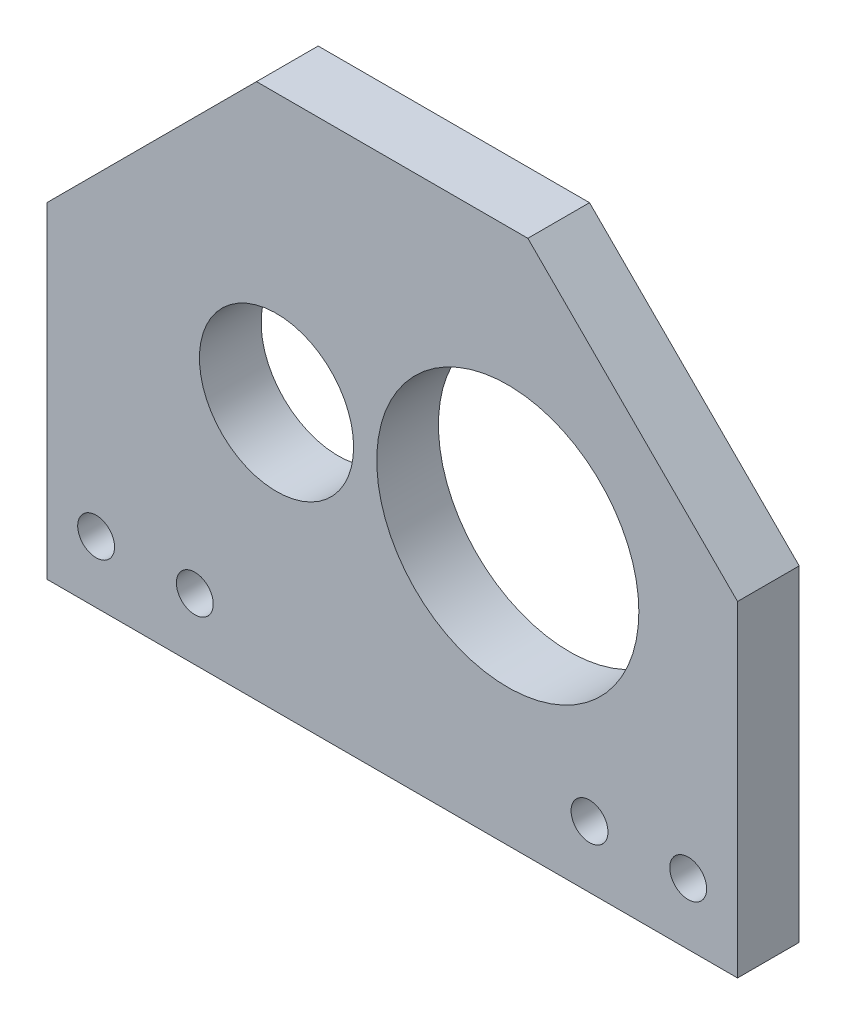
from build123d import *

# Parameters (mm, degrees)
SKETCH1_W             = 71.12
SKETCH1_H             = 55.16372
SKETCH1_R             = 13.49375
SKETCH1_R_2           = 7.9375
BOSS_EXTRUDE1_DEPTH   = 6.35
F_6_CLEARANCE_HOLE1_D = 3.7973
CUT_EXTRUDE1_DEPTH    = 46.448818478


with BuildPart() as part:
    # Sketch1 → Boss-Extrude1 (new body)
    with BuildSketch(Plane.XY):
        Rectangle(SKETCH1_W, SKETCH1_H)
        with Locations((11.90625, 0)):
            Circle(SKETCH1_R, mode=Mode.SUBTRACT)
        with Locations((-11.90625, 0)):
            Circle(SKETCH1_R_2, mode=Mode.SUBTRACT)
    extrude(amount=BOSS_EXTRUDE1_DEPTH)

    # #6 Clearance Hole1 (through all)
    with Locations(Plane.XY.offset(6.35)):
        with Locations((-30.48, -21.23186), (-20.32, -21.23186), (20.32, -21.23186), (30.48, -21.23186)):
            Hole(F_6_CLEARANCE_HOLE1_D / 2)

    # Sketch4 → Cut-Extrude1 (cut, through all)
    with BuildSketch(Plane.XY.offset(6.35)):
        Polygon((-35.56, 5.99186), (-13.97, 27.58186), (-35.56, 27.58186), align=None)
        Polygon((35.56, 5.99186), (13.97, 27.58186), (35.56, 27.58186), align=None)
    extrude(amount=-CUT_EXTRUDE1_DEPTH, mode=Mode.SUBTRACT)


solid = part.part
